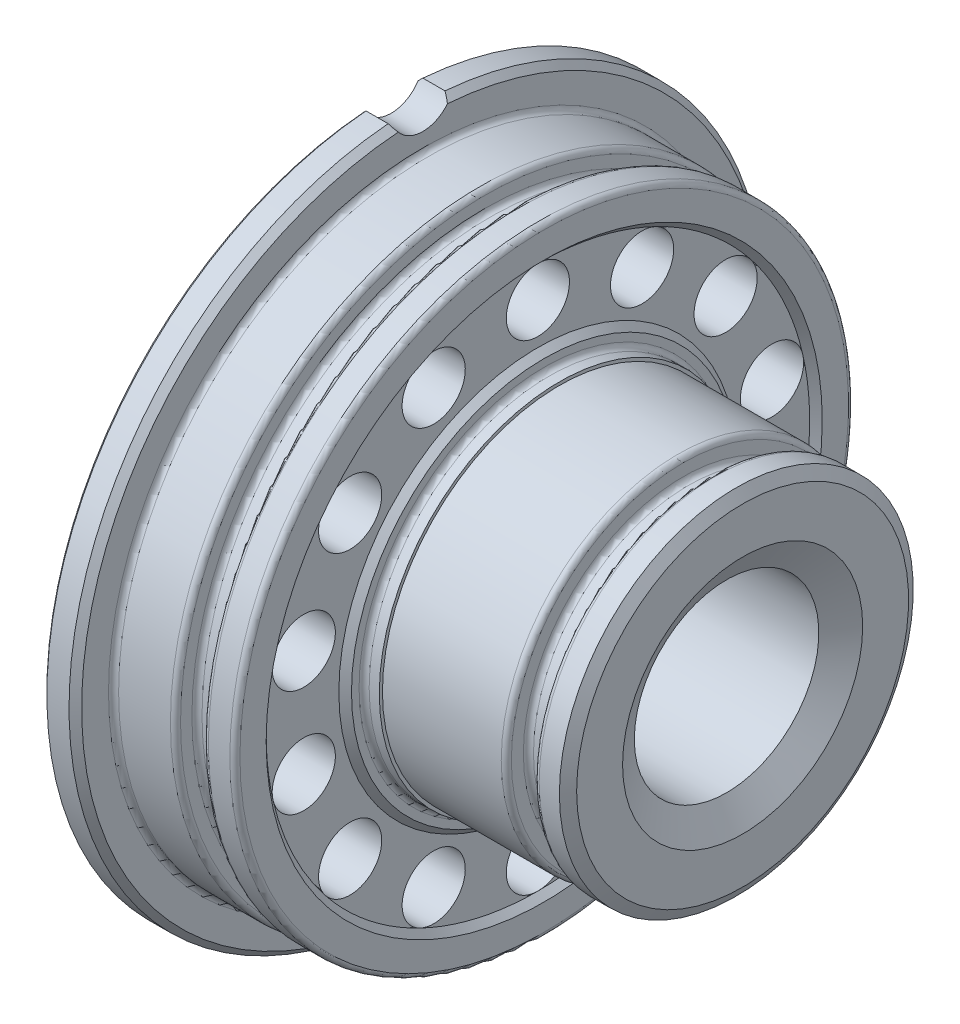
from build123d import *

# Parameters (mm, degrees)
EXTRUDE1_REACH    = 49.805
SKETCH2_R         = 2.5
EXTRUDE2_REACH    = 49.805
SKETCH3_R         = 2.5
CIRPATTERN1_COUNT = 7


with BuildPart() as part:
    # Sketch1 → Revolve1 (revolve)
    with BuildSketch(Plane.XY):
        with BuildLine():
            Line((0.4, 7.3), (26.529829408, 7.3))
            Line((26.529829408, 7.3), (27.8, 9.5))
            Line((27.8, 9.5), (27.8, 13.133974596))
            Line((27.8, 13.133974596), (27.3, 14))
            Line((27.3, 14), (25.7, 14))
            ThreePointArc((25.7, 14), (25.417157288, 13.882842712), (25.3, 13.6))
            Line((25.3, 13.6), (25.3, 12.65))
            ThreePointArc((25.3, 12.65), (25.182842712, 12.367157288), (24.9, 12.25))
            Line((24.9, 12.25), (23.5, 12.25))
            ThreePointArc((23.5, 12.25), (23.217157288, 12.367157288), (23.1, 12.65))
            Line((23.1, 12.65), (23.1, 13.6))
            ThreePointArc((23.1, 13.6), (22.982842712, 13.882842712), (22.7, 14))
            Line((22.7, 14), (13.3, 14))
            Line((13.3, 14), (13.3, 14.25))
            Line((13.3, 14.25), (12.5, 14.25))
            ThreePointArc((12.5, 14.25), (12.217157288, 14.367157288), (12.1, 14.65))
            Line((12.1, 14.65), (12.1, 15.25))
            Line((12.1, 15.25), (11.6, 15.75))
            Line((11.6, 15.75), (11.6, 21.5))
            Line((11.6, 21.5), (12.1, 22))
            Line((12.1, 22), (12.1, 24.075))
            ThreePointArc((12.1, 24.075), (11.982842712, 24.357842712), (11.7, 24.475))
            Line((11.7, 24.475), (10, 24.475))
            ThreePointArc((10, 24.475), (9.717157288, 24.357842712), (9.6, 24.075))
            Line((9.6, 24.075), (9.6, 23.175))
            ThreePointArc((9.6, 23.175), (9.482842712, 22.892157288), (9.2, 22.775))
            Line((9.2, 22.775), (7.8, 22.775))
            ThreePointArc((7.8, 22.775), (7.517157288, 22.892157288), (7.4, 23.175))
            Line((7.4, 23.175), (7.4, 24.075))
            ThreePointArc((7.4, 24.075), (7.282842712, 24.357842712), (7, 24.475))
            Line((7, 24.475), (2.9, 24.475))
            ThreePointArc((2.9, 24.475), (2.617157288, 24.592157288), (2.5, 24.875))
            Line((2.5, 24.875), (2.5, 27))
            Line((2.5, 27), (2, 27.5))
            Line((2, 27.5), (0.25, 27.5))
            Line((0.25, 27.5), (0, 27.25))
            Line((0, 27.25), (0, 13.9))
            Line((0, 13.9), (0.4, 13.5))
            Line((0.4, 13.5), (0.4, 7.3))
        make_face()
    revolve(axis=Axis((0, 0, 0), (1, 0, 0)))

    # Sketch2 → Extrude1 (cut, up to next)
    with BuildSketch(Plane.ZY, mode=Mode.PRIVATE) as extrude1_sk1:
        with Locations((0, 19)):
            Circle(SKETCH2_R)
    extrude1_tool1 = extrude(extrude1_sk1.sketch, amount=-EXTRUDE1_REACH, mode=Mode.PRIVATE) & part.part
    # Sketch2 → Extrude1 (cut, up to next)
    with BuildSketch(Plane.ZY, mode=Mode.PRIVATE) as extrude1_sk2:
        with Locations((0, -19)):
            Circle(SKETCH2_R)
    extrude1_tool2 = extrude(extrude1_sk2.sketch, amount=-EXTRUDE1_REACH, mode=Mode.PRIVATE) & part.part
    extrude1_1 = extrude1_tool1.solids().sort_by_distance((0, 19, 0))[0]
    add(extrude1_1, mode=Mode.SUBTRACT)
    extrude1_2 = extrude1_tool2.solids().sort_by_distance((0, -19, 0))[0]
    add(extrude1_2, mode=Mode.SUBTRACT)
    extrude1 = extrude1_1 + extrude1_2  # Extrude1 as one shape, for the pattern or mirror that repeats it

    # Sketch3 → Extrude2 (cut, up to next)
    with BuildSketch(Plane.ZY, mode=Mode.PRIVATE) as extrude2_sk1:
        with Locations((0, 28.5)):
            Circle(SKETCH3_R)
    extrude2_tool1 = extrude(extrude2_sk1.sketch, amount=-EXTRUDE2_REACH, mode=Mode.PRIVATE) & part.part
    add(extrude2_tool1.solids().sort_by_distance((0, 28.5, 0))[0], mode=Mode.SUBTRACT)

    # CirPattern1: Extrude1 ×7 about axis
    cirpattern1_axis = Axis((0, 0, 0), (-1, 0, 0))
    for i in range(1, CIRPATTERN1_COUNT):
        add(extrude1.rotate(cirpattern1_axis, i * 360 / CIRPATTERN1_COUNT), mode=Mode.SUBTRACT)


solid = part.part
